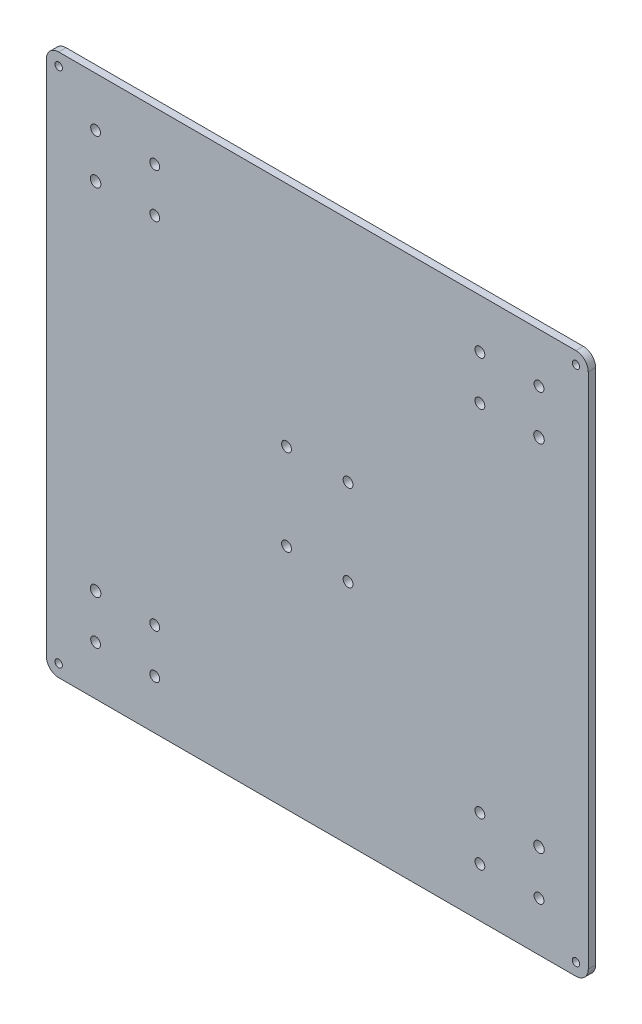
from build123d import *

# Parameters (mm, degrees)
SZKIC1_W                    = 220
SZKIC1_H                    = 220
DODANIE_WYCI_GNI_CIE1_DEPTH = 3
SZKIC2_R                    = 1.5
WYTNIJ_WYCI_GNI_CIE1_DEPTH  = 3
SZKIC3_R                    = 1.5
WYTNIJ_WYCI_GNI_CIE2_DEPTH  = 3
SZKIC4_R                    = 2
WYTNIJ_WYCI_GNI_CIE3_DEPTH  = 3
ZAOKR_GLENIE1_R             = 5
WYTNIJ_WYCI_GNI_CIE4_REACH  = 157.592
SZKIC6_R                    = 2.140240334
SZKIC6_R_2                  = 2
LUSTRO2_COPY_1_REACH        = 157.592
LUSTRO2_COPY_1_SKETCH_R     = 2.140240334
LUSTRO2_COPY_1_SKETCH_R_2   = 2


with BuildPart() as part:
    # Szkic1 → Dodanie-wyciągnięcie1 (new body)
    with BuildSketch(Plane.XY):
        Rectangle(SZKIC1_W, SZKIC1_H)
    extrude(amount=DODANIE_WYCI_GNI_CIE1_DEPTH)

    # Szkic2 → Wytnij-wyciągnięcie1 (cut)
    with BuildSketch(Plane.XY.offset(3)):
        with Locations((105, 105)):
            Circle(SZKIC2_R)
    extrude(amount=-WYTNIJ_WYCI_GNI_CIE1_DEPTH, mode=Mode.SUBTRACT)

    # Szkic3 → Wytnij-wyciągnięcie2 (cut)
    with BuildSketch(Plane.XY.offset(3)):
        with Locations((-105, 105)):
            Circle(SZKIC3_R)
        with Locations((-105, -105)):
            Circle(SZKIC3_R)
        with Locations((105, -105)):
            Circle(SZKIC3_R)
    extrude(amount=-WYTNIJ_WYCI_GNI_CIE2_DEPTH, mode=Mode.SUBTRACT)

    # Szkic4 → Wytnij-wyciągnięcie3 (cut)
    with BuildSketch(Plane.XY.offset(3)):
        with Locations((-12.5, -17.5)):
            Circle(SZKIC4_R)
        with Locations((-12.5, 17.5)):
            Circle(SZKIC4_R)
        with Locations((12.5, 17.5)):
            Circle(SZKIC4_R)
        with Locations((12.5, -17.5)):
            Circle(SZKIC4_R)
    extrude(amount=-WYTNIJ_WYCI_GNI_CIE3_DEPTH, mode=Mode.SUBTRACT)

    # Zaokrąglenie1
    zaokr_glenie1_edges = [part.edges().sort_by_distance(p)[0] for p in [
        (110, 110, 1.5),
        (-110, 110, 1.5),
        (-110, -110, 1.5),
        (110, -110, 1.5),
    ]]
    fillet(zaokr_glenie1_edges, radius=ZAOKR_GLENIE1_R)

    # Szkic6 → Wytnij-wyciągnięcie4 (cut, up to next)
    with BuildSketch(Plane(origin=(0, 0, 0), x_dir=(-1, 0, 0), z_dir=(0, 0, -1)), mode=Mode.PRIVATE) as wytnij_wyci_gni_cie4_sk1:
        with Locations((-90, -72)):
            Circle(SZKIC6_R)
    wytnij_wyci_gni_cie4_tool1 = extrude(wytnij_wyci_gni_cie4_sk1.sketch, amount=-WYTNIJ_WYCI_GNI_CIE4_REACH, mode=Mode.PRIVATE) & part.part
    # Szkic6 → Wytnij-wyciągnięcie4 (cut, up to next)
    with BuildSketch(Plane(origin=(0, 0, 0), x_dir=(-1, 0, 0), z_dir=(0, 0, -1)), mode=Mode.PRIVATE) as wytnij_wyci_gni_cie4_sk2:
        with Locations((-66, -72)):
            Circle(SZKIC6_R_2)
    wytnij_wyci_gni_cie4_tool2 = extrude(wytnij_wyci_gni_cie4_sk2.sketch, amount=-WYTNIJ_WYCI_GNI_CIE4_REACH, mode=Mode.PRIVATE) & part.part
    # Szkic6 → Wytnij-wyciągnięcie4 (cut, up to next)
    with BuildSketch(Plane(origin=(0, 0, 0), x_dir=(-1, 0, 0), z_dir=(0, 0, -1)), mode=Mode.PRIVATE) as wytnij_wyci_gni_cie4_sk3:
        with Locations((-66, -90)):
            Circle(SZKIC6_R_2)
    wytnij_wyci_gni_cie4_tool3 = extrude(wytnij_wyci_gni_cie4_sk3.sketch, amount=-WYTNIJ_WYCI_GNI_CIE4_REACH, mode=Mode.PRIVATE) & part.part
    # Szkic6 → Wytnij-wyciągnięcie4 (cut, up to next)
    with BuildSketch(Plane(origin=(0, 0, 0), x_dir=(-1, 0, 0), z_dir=(0, 0, -1)), mode=Mode.PRIVATE) as wytnij_wyci_gni_cie4_sk4:
        with Locations((-90, -90)):
            Circle(SZKIC6_R_2)
    wytnij_wyci_gni_cie4_tool4 = extrude(wytnij_wyci_gni_cie4_sk4.sketch, amount=-WYTNIJ_WYCI_GNI_CIE4_REACH, mode=Mode.PRIVATE) & part.part
    wytnij_wyci_gni_cie4_1 = wytnij_wyci_gni_cie4_tool1.solids().sort_by_distance((90, -72, 0))[0]
    add(wytnij_wyci_gni_cie4_1, mode=Mode.SUBTRACT)
    wytnij_wyci_gni_cie4_2 = wytnij_wyci_gni_cie4_tool2.solids().sort_by_distance((66, -72, 0))[0]
    add(wytnij_wyci_gni_cie4_2, mode=Mode.SUBTRACT)
    wytnij_wyci_gni_cie4_3 = wytnij_wyci_gni_cie4_tool3.solids().sort_by_distance((66, -90, 0))[0]
    add(wytnij_wyci_gni_cie4_3, mode=Mode.SUBTRACT)
    wytnij_wyci_gni_cie4_4 = wytnij_wyci_gni_cie4_tool4.solids().sort_by_distance((90, -90, 0))[0]
    add(wytnij_wyci_gni_cie4_4, mode=Mode.SUBTRACT)
    wytnij_wyci_gni_cie4 = wytnij_wyci_gni_cie4_1 + wytnij_wyci_gni_cie4_2 + wytnij_wyci_gni_cie4_3 + wytnij_wyci_gni_cie4_4  # Wytnij-wyciągnięcie4 as one shape, for the pattern or mirror that repeats it

    # Lustro1: Wytnij-wyciągnięcie4 across plane
    add(wytnij_wyci_gni_cie4.mirror(Plane(origin=(0, 0, 0), x_dir=(0, 0, 1), z_dir=(1, 0, 0))), mode=Mode.SUBTRACT)

    # Lustro2: Wytnij-wyciągnięcie4 across plane
    add(wytnij_wyci_gni_cie4.mirror(Plane.ZX), mode=Mode.SUBTRACT)

    # Lustro2 copy 1 sketch → Lustro2 copy 1 (cut, up to next)
    with BuildSketch(Plane(origin=(0, 0, 0), x_dir=(1, 0, 0), z_dir=(0, 0, -1)), mode=Mode.PRIVATE) as lustro2_copy_1_sk1:
        with Locations((-90, -72)):
            Circle(LUSTRO2_COPY_1_SKETCH_R)
    lustro2_copy_1_tool1 = extrude(lustro2_copy_1_sk1.sketch, amount=-LUSTRO2_COPY_1_REACH, mode=Mode.PRIVATE) & part.part
    # Lustro2 copy 1 sketch → Lustro2 copy 1 (cut, up to next)
    with BuildSketch(Plane(origin=(0, 0, 0), x_dir=(1, 0, 0), z_dir=(0, 0, -1)), mode=Mode.PRIVATE) as lustro2_copy_1_sk2:
        with Locations((-66, -72)):
            Circle(LUSTRO2_COPY_1_SKETCH_R_2)
    lustro2_copy_1_tool2 = extrude(lustro2_copy_1_sk2.sketch, amount=-LUSTRO2_COPY_1_REACH, mode=Mode.PRIVATE) & part.part
    # Lustro2 copy 1 sketch → Lustro2 copy 1 (cut, up to next)
    with BuildSketch(Plane(origin=(0, 0, 0), x_dir=(1, 0, 0), z_dir=(0, 0, -1)), mode=Mode.PRIVATE) as lustro2_copy_1_sk3:
        with Locations((-66, -90)):
            Circle(LUSTRO2_COPY_1_SKETCH_R_2)
    lustro2_copy_1_tool3 = extrude(lustro2_copy_1_sk3.sketch, amount=-LUSTRO2_COPY_1_REACH, mode=Mode.PRIVATE) & part.part
    # Lustro2 copy 1 sketch → Lustro2 copy 1 (cut, up to next)
    with BuildSketch(Plane(origin=(0, 0, 0), x_dir=(1, 0, 0), z_dir=(0, 0, -1)), mode=Mode.PRIVATE) as lustro2_copy_1_sk4:
        with Locations((-90, -90)):
            Circle(LUSTRO2_COPY_1_SKETCH_R_2)
    lustro2_copy_1_tool4 = extrude(lustro2_copy_1_sk4.sketch, amount=-LUSTRO2_COPY_1_REACH, mode=Mode.PRIVATE) & part.part
    add(lustro2_copy_1_tool1.solids().sort_by_distance((-90, 72, 0))[0], mode=Mode.SUBTRACT)
    add(lustro2_copy_1_tool2.solids().sort_by_distance((-66, 72, 0))[0], mode=Mode.SUBTRACT)
    add(lustro2_copy_1_tool3.solids().sort_by_distance((-66, 90, 0))[0], mode=Mode.SUBTRACT)
    add(lustro2_copy_1_tool4.solids().sort_by_distance((-90, 90, 0))[0], mode=Mode.SUBTRACT)


solid = part.part
